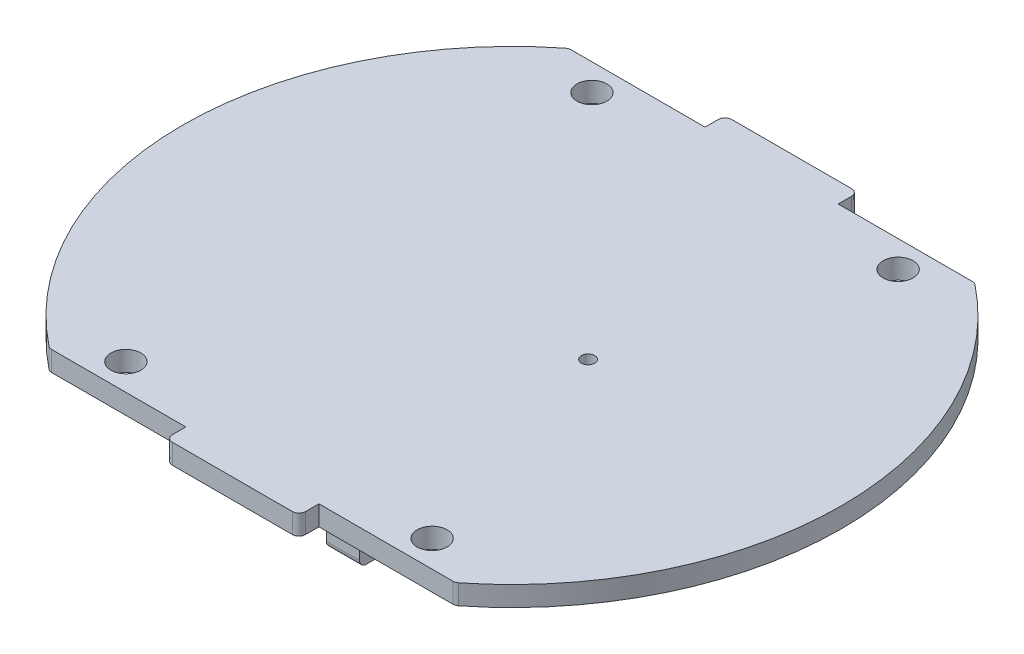
from build123d import *

# Parameters (mm, degrees)
A_BASE_T42_OUTLINE_R          = 2.2479
A_BASE_T42_OUTLINE_R_2        = 1
A_BASE_T42_DEPTH              = 3
OUTER_RIM_CUT_DEPTH           = 68.299702823
SKETCH2_W                     = 20
SKETCH2_H                     = 3
FLANGES_DEPTH                 = 3
CONTOURING_R                  = 1
SKETCH9_R                     = 1
SINGLE_TENDON_PORT_DEPTH      = 65.986537067
SKETCH3_W                     = 15
SKETCH3_H                     = 3
SKETCH3_W_2                   = 3
SKETCH3_H_2                   = 15
BASE_SUPPORTS_DEPTH           = 3
BASE_SUPPORTS_CHAMFER_SIZE    = 3
SKETCH10_R                    = 1
COVER_DEPTH                   = 3
SKETCH6_W                     = 5
SKETCH6_H                     = 55.64
SERVO_SIDE_SUPPORTS_DEPTH     = 8.5
SKETCH7_W                     = 5
SKETCH7_H                     = 7.82
SERVO_SIDE_SUPPORT_ENDS_DEPTH = 5
SERVO_CONTOURING_R            = 1


with BuildPart() as part:
    # a_base_t42: read off the stored shape, not the designer's step
    # a_base_t42 outline → a_base_t42 (new body)
    with BuildSketch(Plane(origin=(0, 0, 0), x_dir=(1, 0, 0), z_dir=(0, 1, 0))):
        with BuildLine():
            ThreePointArc((31.5, -42), (52.5, 0), (31.5, 42))
            Line((31.5, 42), (-31.5, 42))
            ThreePointArc((-31.5, 42), (-52.5, 0), (-31.5, -42))
            Line((-31.5, -42), (31.5, -42))
        make_face()
        with Locations((-23, -35)):
            Circle(A_BASE_T42_OUTLINE_R, mode=Mode.SUBTRACT)
        with Locations((23, -35)):
            Circle(A_BASE_T42_OUTLINE_R, mode=Mode.SUBTRACT)
        with Locations((-40.25, 0)):
            Circle(A_BASE_T42_OUTLINE_R_2, mode=Mode.SUBTRACT)
        with Locations((-23, 35)):
            Circle(A_BASE_T42_OUTLINE_R, mode=Mode.SUBTRACT)
        with Locations((40.25, 0)):
            Circle(A_BASE_T42_OUTLINE_R_2, mode=Mode.SUBTRACT)
        with Locations((23, 35)):
            Circle(A_BASE_T42_OUTLINE_R, mode=Mode.SUBTRACT)
    extrude(amount=A_BASE_T42_DEPTH)

    # Sketch1 → Outer Rim Cut (cut, through all)
    with BuildSketch(Plane.XZ):
        with BuildLine():
            Line((31.5, 42), (-31.5, 42))
            ThreePointArc((-31.5, 42), (-52.5, 0), (-31.5, -42))
            Line((-31.5, -42), (31.5, -42))
            ThreePointArc((31.5, -42), (52.5, 0), (31.5, 42))
        make_face()
        with BuildLine():
            Line((30.483602149, 39), (-30.483602149, 39))
            ThreePointArc((-30.483602149, 39), (-49.5, 0), (-30.483602149, -39))
            Line((-30.483602149, -39), (30.483602149, -39))
            ThreePointArc((30.483602149, -39), (49.5, 0), (30.483602149, 39))
        make_face(mode=Mode.SUBTRACT)
    extrude(amount=-OUTER_RIM_CUT_DEPTH, mode=Mode.SUBTRACT)

    # Sketch2 → Flanges (add)
    with BuildSketch(Plane.XZ):
        with Locations((0, -40.5)):
            Rectangle(SKETCH2_W, SKETCH2_H)
        with Locations((0, 40.5)):
            Rectangle(SKETCH2_W, SKETCH2_H)
    extrude(amount=-FLANGES_DEPTH)

    # Contouring
    contouring_edges = [part.edges().sort_by_distance(p)[0] for p in [
        (30.483602149, 1.5, -39),
        (-30.483602149, 1.5, -39),
        (10, 1.5, -42),
        (-10, 1.5, -42),
        (30.483602149, 1.5, 39),
        (-30.483602149, 1.5, 39),
        (10, 1.5, 42),
        (-10, 1.5, 42),
    ]]
    fillet(contouring_edges, radius=CONTOURING_R)

    # Sketch9 → Single Tendon Port (cut, through all)
    with BuildSketch(Plane.XZ):
        with Locations(Location((11.425, 0, 0), (0, 0, 270))):
            Circle(SKETCH9_R)
    extrude(amount=-SINGLE_TENDON_PORT_DEPTH, mode=Mode.SUBTRACT)

    # Sketch3 → Base Supports (add)
    with BuildSketch(Plane.XZ):
        with Locations((-25.325, -27)):
            Rectangle(SKETCH3_W, SKETCH3_H)
        with Locations((-25.325, 27)):
            Rectangle(SKETCH3_W, SKETCH3_H)
        with Locations((-34.325, -12.5)):
            Rectangle(SKETCH3_W_2, SKETCH3_H_2)
        with Locations((-34.325, 12.5)):
            Rectangle(SKETCH3_W_2, SKETCH3_H_2)
    extrude(amount=BASE_SUPPORTS_DEPTH)

    # Base Supports Chamfer
    # the kernel refuses this chamfer: 3 mm, written as the material it adds along each edge
    with BuildSketch(Plane(origin=(-32.825, 0, 28.5), x_dir=(0, 0, 1), z_dir=(1, 0, 0))) as base_supports_chamfer_piece_1_section:
        Polygon((BASE_SUPPORTS_CHAMFER_SIZE, 0), (0, BASE_SUPPORTS_CHAMFER_SIZE), (0, 0), align=None)
    base_supports_chamfer_piece_1 = extrude(amount=15, mode=Mode.PRIVATE)
    base_supports_chamfer_piece_1 = split(base_supports_chamfer_piece_1, bisect_by=Plane(origin=(-32.825, -3, 28.5), z_dir=(0, 1, 0)), keep=Keep.TOP, mode=Mode.PRIVATE)
    add(base_supports_chamfer_piece_1)
    with BuildSketch(Plane(origin=(-17.825, 0, -28.5), x_dir=(0, 0, -1), z_dir=(-1, 0, 0))) as base_supports_chamfer_piece_2_section:
        Polygon((BASE_SUPPORTS_CHAMFER_SIZE, 0), (0, BASE_SUPPORTS_CHAMFER_SIZE), (0, 0), align=None)
    base_supports_chamfer_piece_2 = extrude(amount=15, mode=Mode.PRIVATE)
    base_supports_chamfer_piece_2 = split(base_supports_chamfer_piece_2, bisect_by=Plane(origin=(-17.825, -3, -28.5), z_dir=(0, 1, 0)), keep=Keep.TOP, mode=Mode.PRIVATE)
    add(base_supports_chamfer_piece_2)
    with BuildSketch(Plane(origin=(-35.825, 0, 20), x_dir=(-1, 0, 0), z_dir=(0, 0, -1))) as base_supports_chamfer_piece_3_section:
        Polygon((BASE_SUPPORTS_CHAMFER_SIZE, 0), (0, -BASE_SUPPORTS_CHAMFER_SIZE), (0, 0), align=None)
    base_supports_chamfer_piece_3 = extrude(amount=15, mode=Mode.PRIVATE)
    base_supports_chamfer_piece_3 = split(base_supports_chamfer_piece_3, bisect_by=Plane(origin=(-35.825, -3, 20), z_dir=(0, 1, 0)), keep=Keep.TOP, mode=Mode.PRIVATE)
    add(base_supports_chamfer_piece_3)
    with BuildSketch(Plane(origin=(-35.825, 0, -20), x_dir=(-1, 0, 0), z_dir=(0, 0, 1))) as base_supports_chamfer_piece_4_section:
        Polygon((BASE_SUPPORTS_CHAMFER_SIZE, 0), (0, BASE_SUPPORTS_CHAMFER_SIZE), (0, 0), align=None)
    base_supports_chamfer_piece_4 = extrude(amount=15, mode=Mode.PRIVATE)
    base_supports_chamfer_piece_4 = split(base_supports_chamfer_piece_4, bisect_by=Plane(origin=(-35.825, -3, -20), z_dir=(0, 1, 0)), keep=Keep.TOP, mode=Mode.PRIVATE)
    add(base_supports_chamfer_piece_4)

    # Sketch10 → Cover (add)
    with BuildSketch(Plane.XZ):
        with Locations((-40.25, 0)):
            Circle(SKETCH10_R)
        with Locations((40.25, 0)):
            Circle(SKETCH10_R)
    extrude(amount=-COVER_DEPTH)

    # Sketch6 → Servo Side Supports (add)
    with BuildSketch(Plane.XZ):
        with Locations((2.425, 0)):
            Rectangle(SKETCH6_W, SKETCH6_H)
    extrude(amount=SERVO_SIDE_SUPPORTS_DEPTH)

    # Sketch7 → Servo Side Support Ends (add)
    with BuildSketch(Plane.XZ.offset(8.5)):
        with Locations((2.425, 23.91)):
            Rectangle(SKETCH7_W, SKETCH7_H)
        with Locations((2.425, -23.91)):
            Rectangle(SKETCH7_W, SKETCH7_H)
    extrude(amount=SERVO_SIDE_SUPPORT_ENDS_DEPTH)

    # Servo Contouring
    servo_contouring_edges = [part.edges().sort_by_distance(p)[0] for p in [
        (2.425, 0, -27.82),
        (2.425, 0, 27.82),
        (2.425, -13.5, 20),
        (2.425, -13.5, 27.82),
        (2.425, -13.5, -27.82),
        (2.425, -13.5, -20),
    ]]
    fillet(servo_contouring_edges, radius=SERVO_CONTOURING_R)


solid = part.part
